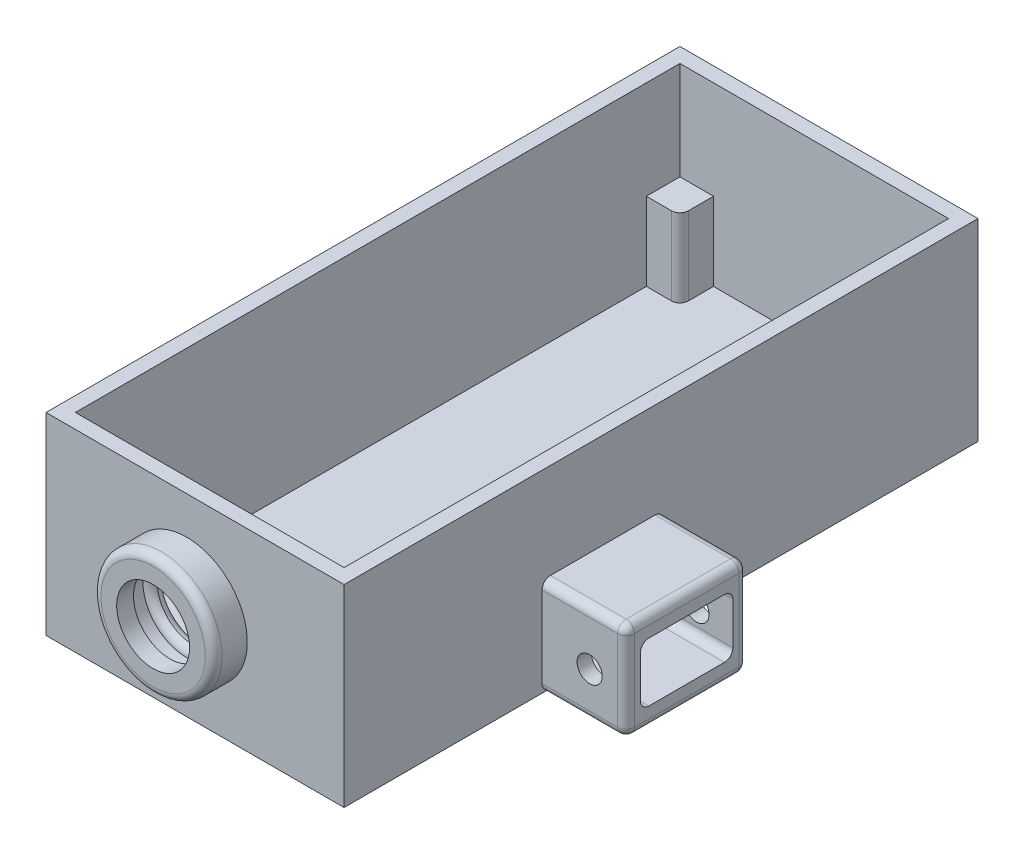
from build123d import *

# Parameters (mm, degrees)
SKETCH1_W           = 35.5
SKETCH1_H           = 75.5
BOSS_EXTRUDE2_DEPTH = 23
CUT_EXTRUDE1_DEPTH  = 21
SKETCH2_W           = 4
SKETCH2_H           = 4
BOSS_EXTRUDE3_DEPTH = 9.3
CUT_EXTRUDE2_START  = -15.05
SKETCH3_W           = 3.25
SKETCH3_H           = 9
CUT_EXTRUDE2_DEPTH  = 4.25
SKETCH6_R           = 4.25
CUT_EXTRUDE4_DEPTH  = 1.75
FILLET1_R           = 1
FILLET2_R           = 1
SKETCH7_R           = 7.218245837
SKETCH7_R_2         = 5.218245837
BOSS_EXTRUDE4_DEPTH = 2
SKETCH9_R           = 7.218245837
BOSS_EXTRUDE5_DEPTH = 2
FILLET4_R           = 1
SKETCH10_R          = 4.340870449
CUT_EXTRUDE5_DEPTH  = 2
FILLET5_R           = 1
FILLET6_R           = 1
FILLET7_R           = 1
FILLET9_R           = 1
BOSS_EXTRUDE7_DEPTH = 10
FILLET10_R          = 1
SKETCH13_R          = 1.5
CUT_EXTRUDE6_DEPTH  = 21


with BuildPart() as part:
    # Sketch1 → Boss-Extrude2 (new body)
    with BuildSketch(Plane(origin=(0, 0, 0), x_dir=(1, 0, 0), z_dir=(0, 1, 0))):
        with Locations((17.75, 37.75)):
            Rectangle(SKETCH1_W, SKETCH1_H)
    extrude(amount=BOSS_EXTRUDE2_DEPTH)

    # 3DSketch1 → Cut-Extrude1 (cut)
    with BuildSketch(Plane(origin=(33.75, 23, -1.75), x_dir=(-0.40613846605344744, 0, -0.9138115486202573), z_dir=(0, 1, 0))):
        Polygon((0, 0), (65.794431501, -29.241969556), (78.790862414, 0), (12.996430914, 29.241969556), align=None)
    extrude(amount=-CUT_EXTRUDE1_DEPTH, mode=Mode.SUBTRACT)

    # Sketch2 → Boss-Extrude3 (add)
    with BuildSketch(Plane(origin=(0, 2, 0), x_dir=(1, 0, 0), z_dir=(0, 1, 0))):
        with Locations((3.75, 71.75)):
            Rectangle(SKETCH2_W, SKETCH2_H)
        with Locations((31.75, 71.75)):
            Rectangle(SKETCH2_W, SKETCH2_H)
        with Locations((31.75, 3.75)):
            Rectangle(SKETCH2_W, SKETCH2_H)
        with Locations((3.75, 3.75)):
            Rectangle(SKETCH2_W, SKETCH2_H)
    extrude(amount=BOSS_EXTRUDE3_DEPTH)

    # Sketch3 → Cut-Extrude2 (cut)
    with BuildSketch(Plane(origin=(0, 23, 0), x_dir=(1, 0, 0), z_dir=(0, 1, 0)).offset(CUT_EXTRUDE2_START)):
        with Locations((33.875, 30.8)):
            Rectangle(SKETCH3_W, SKETCH3_H)
    extrude(amount=-CUT_EXTRUDE2_DEPTH, mode=Mode.SUBTRACT)

    # Sketch6 → Cut-Extrude4 (cut)
    with BuildSketch(Plane.XY):
        with Locations((16.758366621, 11.3)):
            Circle(SKETCH6_R)
    extrude(amount=-CUT_EXTRUDE4_DEPTH, mode=Mode.SUBTRACT)

    # Fillet1
    fillet1_edges = [part.edges().sort_by_distance(p)[0] for p in [
        (12.508366621, 11.3, -1.75),
    ]]
    fillet(fillet1_edges, radius=FILLET1_R)

    # Fillet2
    # the kernel refuses this fillet: 1 mm, written as the material it takes off along each edge
    with BuildSketch(Plane(origin=(16.758366621, 11.3, 0), x_dir=(1, 0, 0), z_dir=(0, -1, 0))) as fillet2_piece_1:
        with BuildLine():
            CenterArc((5.218245837, -1), FILLET2_R, 90, 75.522487814)
            Line((5.218245837, 0), (5.218245837, 0.02))
            Line((5.218245837, 0.02), (4.25, 0.02))
            Line((4.25, 0.02), (4.23, 0))
            ThreePointArc((4.23, 0), (4.23, -0.375), (4.230635083, -0.745))
            Line((4.230635083, -0.745), (4.25, -0.75))
        make_face()
    revolve(axis=Axis((16.758366621, 11.3, 0), (0, 0, 1)), mode=Mode.SUBTRACT)

    # Sketch7 → Boss-Extrude4 (add)
    with BuildSketch(Plane.XY):
        with Locations(Location((16.758366621, 11.3, 0), (0, 0, 180))):
            Circle(SKETCH7_R)
        with Locations(Location((16.758366621, 11.3, 0), (0, 0, 180))):
            Circle(SKETCH7_R_2, mode=Mode.SUBTRACT)
    extrude(amount=BOSS_EXTRUDE4_DEPTH)

    # Sketch9 → Boss-Extrude5 (add)
    with BuildSketch(Plane.XY.offset(2)):
        with Locations(Location((16.758366621, 11.3, 0), (0, 0, 180))):
            Circle(SKETCH9_R)
    extrude(amount=BOSS_EXTRUDE5_DEPTH)

    # Fillet4
    fillet4_edges = [part.edges().sort_by_distance(p)[0] for p in [
        (23.976612458, 11.3, 4),
    ]]
    fillet(fillet4_edges, radius=FILLET4_R)

    # Sketch10 → Cut-Extrude5 (cut)
    with BuildSketch(Plane.XY.offset(4)):
        with Locations((16.758366621, 11.3)):
            Circle(SKETCH10_R)
    extrude(amount=-CUT_EXTRUDE5_DEPTH, mode=Mode.SUBTRACT)

    # Fillet5
    fillet5_edges = [part.edges().sort_by_distance(p)[0] for p in [
        (34.625, 3.7, -26.3),
    ]]
    fillet(fillet5_edges, radius=FILLET5_R)

    # Fillet6
    fillet6_edges = [part.edges().sort_by_distance(p)[0] for p in [
        (34.625, 3.7, -35.3),
    ]]
    fillet(fillet6_edges, radius=FILLET6_R)

    # Fillet7
    fillet7_edges = [part.edges().sort_by_distance(p)[0] for p in [
        (5.75, 6.65, -69.75),
        (29.75, 6.65, -69.75),
        (29.75, 6.65, -5.75),
        (5.75, 6.65, -5.75),
    ]]
    fillet(fillet7_edges, radius=FILLET7_R)

    # Fillet9
    fillet9_edges = [part.edges().sort_by_distance(p)[0] for p in [
        (34.625, 7.95, -26.3),
        (34.625, 7.95, -35.3),
    ]]
    fillet(fillet9_edges, radius=FILLET9_R)

    # Sketch12 → Boss-Extrude7 (add)
    with BuildSketch(Plane(origin=(35.5, 0, 0), x_dir=(0, 0, -1), z_dir=(1, 0, 0))):
        with BuildLine():
            Line((37.020541431, 11.65), (24.579458569, 11.65))
            ThreePointArc((24.579458569, 11.65), (23.872351788, 11.357106781), (23.579458569, 10.65))
            Line((23.579458569, 10.65), (23.579458569, 1))
            ThreePointArc((23.579458569, 1), (23.872351788, 0.292893219), (24.579458569, 0))
            Line((24.579458569, 0), (37.020541431, 0))
            ThreePointArc((37.020541431, 0), (37.727648212, 0.292893219), (38.020541431, 1))
            Line((38.020541431, 1), (38.020541431, 10.65))
            ThreePointArc((38.020541431, 10.65), (37.727648212, 11.357106781), (37.020541431, 11.65))
        make_face()
        with BuildLine():
            Line((35.3, 9.325), (26.3, 9.325))
            ThreePointArc((26.3, 9.325), (25.592893219, 9.032106781), (25.3, 8.325))
            Line((25.3, 8.325), (25.3, 3.325))
            ThreePointArc((25.3, 3.325), (25.592893219, 2.617893219), (26.3, 2.325))
            Line((26.3, 2.325), (35.3, 2.325))
            ThreePointArc((35.3, 2.325), (36.007106781, 2.617893219), (36.3, 3.325))
            Line((36.3, 3.325), (36.3, 8.325))
            ThreePointArc((36.3, 8.325), (36.007106781, 9.032106781), (35.3, 9.325))
        make_face(mode=Mode.SUBTRACT)
    extrude(amount=BOSS_EXTRUDE7_DEPTH)

    # Fillet10
    fillet10_edges = [part.edges().sort_by_distance(p)[0] for p in [
        (45.5, 0.292893219, -23.872351788),
        (45.5, 0, -30.8),
        (45.5, 0.292893219, -37.727648212),
        (45.5, 5.825, -38.020541431),
        (45.5, 11.357106781, -37.727648212),
        (45.5, 11.65, -30.8),
        (45.5, 11.357106781, -23.872351788),
        (45.5, 5.825, -23.579458569),
    ]]
    fillet(fillet10_edges, radius=FILLET10_R)

    # Sketch13 → Cut-Extrude6 (cut)
    with BuildSketch(Plane.XY.offset(-23.579458569)):
        with Locations((41.17, 5.31975288)):
            Circle(SKETCH13_R)
    extrude(amount=-CUT_EXTRUDE6_DEPTH, mode=Mode.SUBTRACT)


solid = part.part
